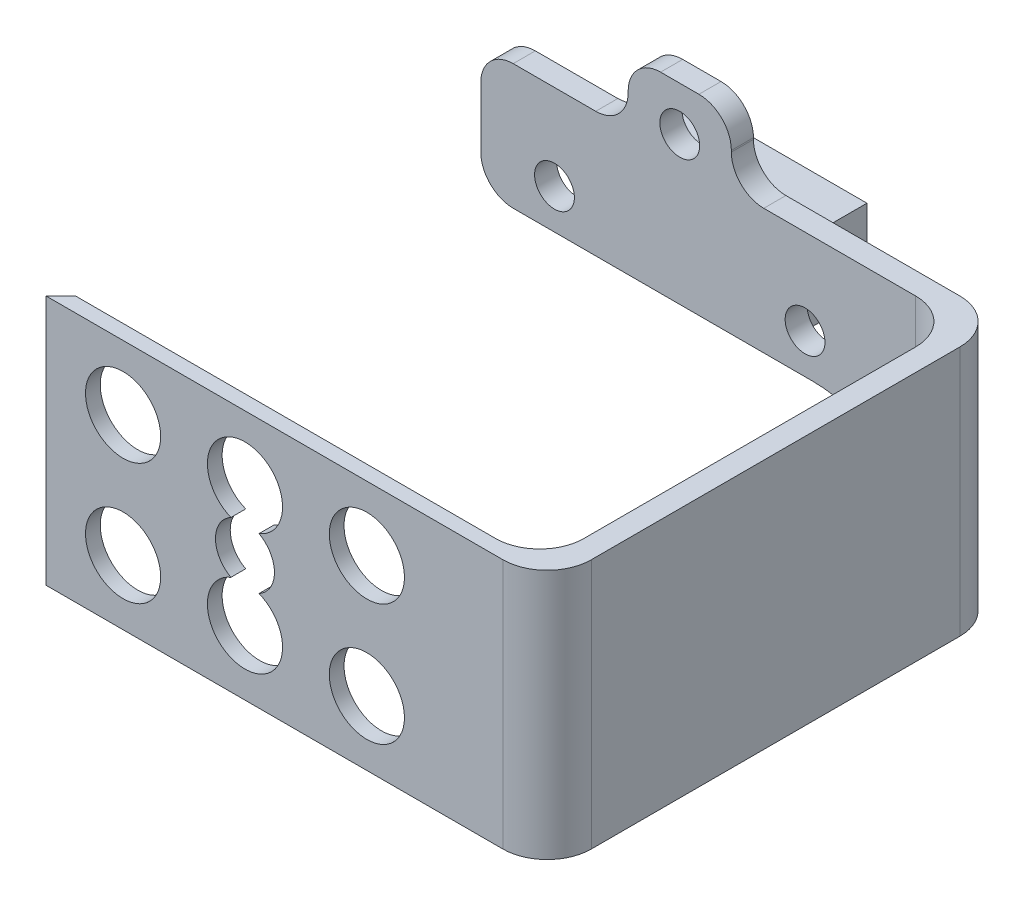
from build123d import *

# Parameters (mm, degrees)
SKETCH_1_W          = 27
SKETCH_1_H          = 17
EXTRUDE_1_DEPTH     = 1
SKETCH_2_R          = 2.55
CUT_EXTRUDE_1_DEPTH = 16.984367363
EXTRUDE_2_DEPTH     = 17
SKETCH_6_W          = 1.5
SKETCH_6_H          = 2
EXTRUDE_3_DEPTH     = 2
CHAMFER_1_SIZE      = 1
CUT_EXTRUDE_4_REACH = 39.316
SKETCH_8_R          = 2
FILLET_1_R          = 3
SKETCH_9_W          = 7
SKETCH_9_H          = 13
EXTRUDE_4_DEPTH     = 1.5
SKETCH_7_R          = 1.35
CUT_EXTRUDE_5_DEPTH = 10
CUT_EXTRUDE_6_REACH = 41.373
FILLET_2_R          = 2.2
SKETCH_13_W         = 11.6
SKETCH_13_H         = 5.4
EXTRUDE_6_DEPTH     = 5.4


with BuildPart() as part:
    # 草图1 → 凸台-拉伸1 (new body)
    with BuildSketch(Plane.XY):
        Rectangle(SKETCH_1_W, SKETCH_1_H)
    extrude(amount=EXTRUDE_1_DEPTH)

    # 草图2 → 切除-拉伸1 (cut, through all)
    with BuildSketch(Plane.XY.offset(1)):
        with Locations((0, 4.125)):
            Circle(SKETCH_2_R)
        with Locations((0, -4.125)):
            Circle(SKETCH_2_R)
        with Locations((8.27, 4.125)):
            Circle(SKETCH_2_R)
        with Locations((8.27, -4.125)):
            Circle(SKETCH_2_R)
        with Locations((-8.27, 4.125)):
            Circle(SKETCH_2_R)
        with Locations((-8.27, -4.125)):
            Circle(SKETCH_2_R)
    extrude(amount=-CUT_EXTRUDE_1_DEPTH, mode=Mode.SUBTRACT)

    # 草图3 → 凸台-拉伸2 (add)
    with BuildSketch(Plane.XZ.offset(8.5)):
        Polygon((13.5, 0), (19, 0), (19, -28.5), (-13.5, -28.5), (-13.5, -30), (20.5, -30), (20.5, 1), (13.5, 1), align=None)
    extrude(amount=-EXTRUDE_2_DEPTH)

    # 草图6 → 凸台-拉伸3 (add, symmetric)
    with BuildSketch(Plane(origin=(0, 0, 0), x_dir=(1, 0, 0), z_dir=(0, 1, 0))):
        Polygon((19, 0), (19, 5), (14, 0), align=None)
        Polygon((19, 28.5), (14, 28.5), (19, 23.5), align=None)
        with Locations((18.25, 20)):
            Rectangle(SKETCH_6_W, SKETCH_6_H)
    extrude(amount=EXTRUDE_3_DEPTH, both=True)

    # 倒角1
    chamfer_1_edges = [part.edges().sort_by_distance(p)[0] for p in [
        (-13.5, 0, 0),
    ]]
    chamfer(chamfer_1_edges, length=CHAMFER_1_SIZE - 0.0001)  # a hair under: the kernel refuses the full size

    # 草图8 → 切除-拉伸4 (cut, up to next)
    with BuildSketch(Plane(origin=(0, 0, 0), x_dir=(-1, 0, 0), z_dir=(0, 0, -1)), mode=Mode.PRIVATE) as cut_extrude_4_sk1:
        Circle(SKETCH_8_R)
    cut_extrude_4_tool1 = extrude(cut_extrude_4_sk1.sketch, amount=-CUT_EXTRUDE_4_REACH, mode=Mode.PRIVATE) & part.part
    add(cut_extrude_4_tool1.solids().sort_by_distance((0, 0, 0))[0], mode=Mode.SUBTRACT)

    # 圆角1
    fillet_1_edges = [part.edges().sort_by_distance(p)[0] for p in [
        (20.5, 0, 1),
        (20.5, 0, -30),
        (19, 5.25, -28.5),
        (19, 5.25, 0),
        (19, -5.25, 0),
        (19, -5.25, -28.5),
    ]]
    fillet(fillet_1_edges, radius=FILLET_1_R)

    # 草图9 → 凸台-拉伸4 (add)
    with BuildSketch(Plane(origin=(0, 0, -30), x_dir=(-1, 0, 0), z_dir=(0, 0, -1))):
        with Locations((0, 6.5)):
            Rectangle(SKETCH_9_W, SKETCH_9_H)
    extrude(amount=-EXTRUDE_4_DEPTH)

    # 草图7 → 切除-拉伸5 (cut)
    with BuildSketch(Plane(origin=(0, 0, -30), x_dir=(-1, 0, 0), z_dir=(0, 0, -1))):
        with Locations((0, 10)):
            Circle(SKETCH_7_R)
        with Locations((-8.5, 2.7)):
            Circle(SKETCH_7_R)
        with Locations((8.5, 2.7)):
            Circle(SKETCH_7_R)
    extrude(amount=-CUT_EXTRUDE_5_DEPTH, mode=Mode.SUBTRACT)

    # 草图11 → 切除-拉伸6 (cut, up to next)
    with BuildSketch(Plane(origin=(0, 0, -30), x_dir=(-1, 0, 0), z_dir=(0, 0, -1)), mode=Mode.PRIVATE) as cut_extrude_6_sk1:
        with BuildLine():
            Line((13.5, -8.5), (13.5, 0))
            Line((13.5, 0), (-9, 0))
            ThreePointArc((-9, 0), (-15.01040764, -2.48959236), (-17.5, -8.5))
            Line((-17.5, -8.5), (13.5, -8.5))
        make_face()
    cut_extrude_6_tool1 = extrude(cut_extrude_6_sk1.sketch, amount=-CUT_EXTRUDE_6_REACH, mode=Mode.PRIVATE) & part.part
    add(cut_extrude_6_tool1.solids().sort_by_distance((1.149624, -4.397011, -30))[0], mode=Mode.SUBTRACT)

    # 圆角2
    fillet_2_edges = [part.edges().sort_by_distance(p)[0] for p in [
        (-3.5, 13, -29.25),
        (-3.5, 8.5, -29.25),
        (3.5, 13, -29.25),
        (3.5, 8.5, -29.25),
        (-13.5, 0, -29.25),
        (-13.5, 8.5, -29.25),
    ]]
    fillet(fillet_2_edges, radius=FILLET_2_R)

    # 草图13 → 凸台-拉伸6 (add)
    with BuildSketch(Plane(origin=(0, 0, -30), x_dir=(-1, 0, 0), z_dir=(0, 0, -1))):
        with Locations((0, 2.7)):
            Rectangle(SKETCH_13_W, SKETCH_13_H)
    extrude(amount=EXTRUDE_6_DEPTH)


solid = part.part
